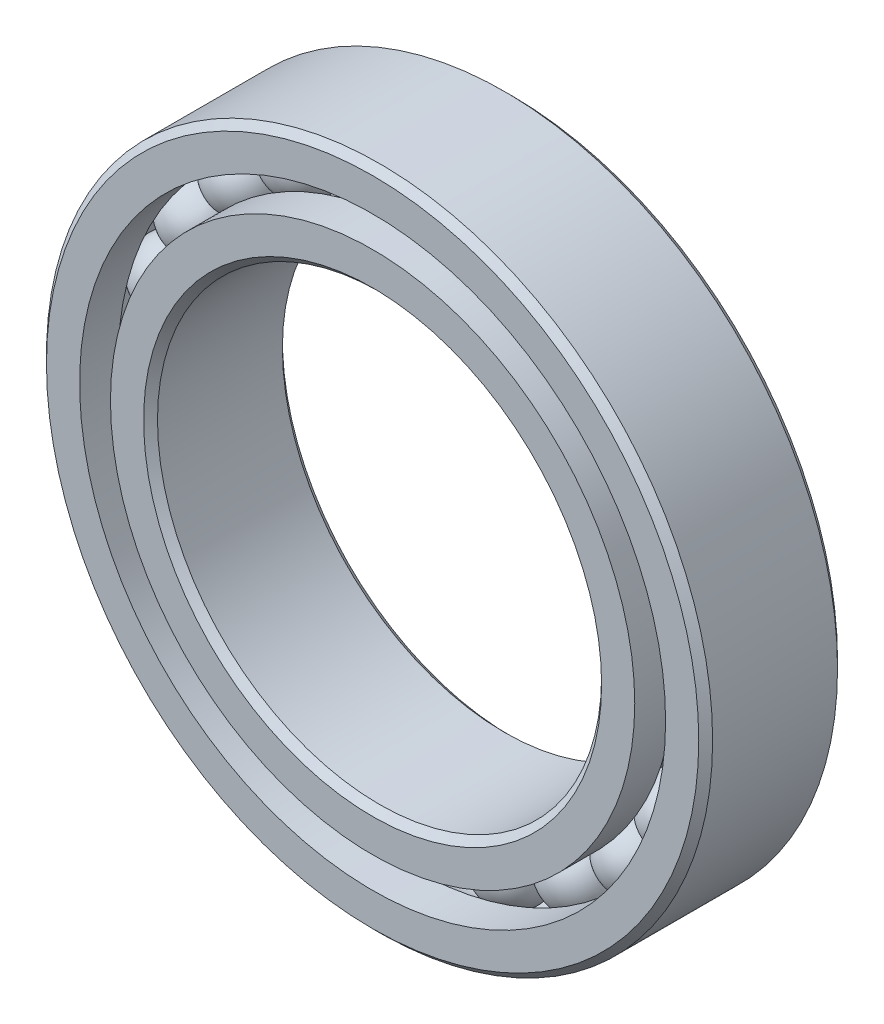
from build123d import *

# Parameters (mm, degrees)
CIRPATTERN1_COUNT = 24


with BuildPart() as part:
    # Sketch2 → Revolve1 (revolve)
    with BuildSketch(Plane(origin=(0, 0, 0), x_dir=(0, 0, -1), z_dir=(1, 0, 0))):
        with BuildLine():
            Line((-1.25, 4.722222222), (-0.555555556, 4.722222222))
            ThreePointArc((-0.555555556, 4.722222222), (0, 4.378870006), (0.555555556, 4.722222222))
            Line((0.555555556, 4.722222222), (1.25, 4.722222222))
            Line((1.25, 4.722222222), (1.25, 4.125))
            Line((1.25, 4.125), (1.125, 4))
            Line((1.125, 4), (-1.125, 4))
            Line((-1.125, 4), (-1.25, 4.125))
            Line((-1.25, 4.125), (-1.25, 4.722222222))
        make_face()
        with BuildLine():
            Line((1.125, 6), (1.25, 5.875))
            Line((1.25, 5.875), (1.25, 5.277777778))
            Line((1.25, 5.277777778), (0.555555556, 5.277777778))
            ThreePointArc((0.555555556, 5.277777778), (0, 5.621129994), (-0.555555556, 5.277777778))
            Line((-0.555555556, 5.277777778), (-1.25, 5.277777778))
            Line((-1.25, 5.277777778), (-1.25, 5.875))
            Line((-1.25, 5.875), (-1.125, 6))
            Line((-1.125, 6), (1.125, 6))
        make_face()
    revolve(axis=Axis((0, 0, 1.25), (0, 0, -1)))


with BuildPart() as body_2:
    # Sketch3 → Revolve2 (revolve)
    with BuildSketch(Plane(origin=(0, 0, 0), x_dir=(0, 0, -1), z_dir=(1, 0, 0))):
        with BuildLine():
            Line((-0.621129994, 5), (0.621129994, 5))
            ThreePointArc((0.621129994, 5), (0, 5.621129994), (-0.621129994, 5))
        make_face()
    revolve(axis=Axis((0, 5, 0.621129994), (0, 0, -1)))


with BuildPart() as cirpattern1_1:
    # CirPattern1: pattern copy
    add(body_2.part.rotate(Axis((0, 0, -1.25), (0, 0, 1)), 1 * 360 / CIRPATTERN1_COUNT))


with BuildPart() as cirpattern1_2:
    # CirPattern1: pattern copy
    add(body_2.part.rotate(Axis((0, 0, -1.25), (0, 0, 1)), 2 * 360 / CIRPATTERN1_COUNT))


with BuildPart() as cirpattern1_3:
    # CirPattern1: pattern copy
    add(body_2.part.rotate(Axis((0, 0, -1.25), (0, 0, 1)), 3 * 360 / CIRPATTERN1_COUNT))


with BuildPart() as cirpattern1_4:
    # CirPattern1: pattern copy
    add(body_2.part.rotate(Axis((0, 0, -1.25), (0, 0, 1)), 4 * 360 / CIRPATTERN1_COUNT))


with BuildPart() as cirpattern1_5:
    # CirPattern1: pattern copy
    add(body_2.part.rotate(Axis((0, 0, -1.25), (0, 0, 1)), 5 * 360 / CIRPATTERN1_COUNT))


with BuildPart() as cirpattern1_6:
    # CirPattern1: pattern copy
    add(body_2.part.rotate(Axis((0, 0, -1.25), (0, 0, 1)), 6 * 360 / CIRPATTERN1_COUNT))


with BuildPart() as cirpattern1_7:
    # CirPattern1: pattern copy
    add(body_2.part.rotate(Axis((0, 0, -1.25), (0, 0, 1)), 7 * 360 / CIRPATTERN1_COUNT))


with BuildPart() as cirpattern1_8:
    # CirPattern1: pattern copy
    add(body_2.part.rotate(Axis((0, 0, -1.25), (0, 0, 1)), 8 * 360 / CIRPATTERN1_COUNT))


with BuildPart() as cirpattern1_9:
    # CirPattern1: pattern copy
    add(body_2.part.rotate(Axis((0, 0, -1.25), (0, 0, 1)), 9 * 360 / CIRPATTERN1_COUNT))


with BuildPart() as cirpattern1_10:
    # CirPattern1: pattern copy
    add(body_2.part.rotate(Axis((0, 0, -1.25), (0, 0, 1)), 10 * 360 / CIRPATTERN1_COUNT))


with BuildPart() as cirpattern1_11:
    # CirPattern1: pattern copy
    add(body_2.part.rotate(Axis((0, 0, -1.25), (0, 0, 1)), 11 * 360 / CIRPATTERN1_COUNT))


with BuildPart() as cirpattern1_12:
    # CirPattern1: pattern copy
    add(body_2.part.rotate(Axis((0, 0, -1.25), (0, 0, 1)), 12 * 360 / CIRPATTERN1_COUNT))


with BuildPart() as cirpattern1_13:
    # CirPattern1: pattern copy
    add(body_2.part.rotate(Axis((0, 0, -1.25), (0, 0, 1)), 13 * 360 / CIRPATTERN1_COUNT))


with BuildPart() as cirpattern1_14:
    # CirPattern1: pattern copy
    add(body_2.part.rotate(Axis((0, 0, -1.25), (0, 0, 1)), 14 * 360 / CIRPATTERN1_COUNT))


with BuildPart() as cirpattern1_15:
    # CirPattern1: pattern copy
    add(body_2.part.rotate(Axis((0, 0, -1.25), (0, 0, 1)), 15 * 360 / CIRPATTERN1_COUNT))


with BuildPart() as cirpattern1_16:
    # CirPattern1: pattern copy
    add(body_2.part.rotate(Axis((0, 0, -1.25), (0, 0, 1)), 16 * 360 / CIRPATTERN1_COUNT))


with BuildPart() as cirpattern1_17:
    # CirPattern1: pattern copy
    add(body_2.part.rotate(Axis((0, 0, -1.25), (0, 0, 1)), 17 * 360 / CIRPATTERN1_COUNT))


with BuildPart() as cirpattern1_18:
    # CirPattern1: pattern copy
    add(body_2.part.rotate(Axis((0, 0, -1.25), (0, 0, 1)), 18 * 360 / CIRPATTERN1_COUNT))


with BuildPart() as cirpattern1_19:
    # CirPattern1: pattern copy
    add(body_2.part.rotate(Axis((0, 0, -1.25), (0, 0, 1)), 19 * 360 / CIRPATTERN1_COUNT))


with BuildPart() as cirpattern1_20:
    # CirPattern1: pattern copy
    add(body_2.part.rotate(Axis((0, 0, -1.25), (0, 0, 1)), 20 * 360 / CIRPATTERN1_COUNT))


with BuildPart() as cirpattern1_21:
    # CirPattern1: pattern copy
    add(body_2.part.rotate(Axis((0, 0, -1.25), (0, 0, 1)), 21 * 360 / CIRPATTERN1_COUNT))


with BuildPart() as cirpattern1_22:
    # CirPattern1: pattern copy
    add(body_2.part.rotate(Axis((0, 0, -1.25), (0, 0, 1)), 22 * 360 / CIRPATTERN1_COUNT))


with BuildPart() as cirpattern1_23:
    # CirPattern1: pattern copy
    add(body_2.part.rotate(Axis((0, 0, -1.25), (0, 0, 1)), 23 * 360 / CIRPATTERN1_COUNT))


solid = Compound([part.part, body_2.part, cirpattern1_1.part, cirpattern1_2.part, cirpattern1_3.part, cirpattern1_4.part, cirpattern1_5.part, cirpattern1_6.part, cirpattern1_7.part, cirpattern1_8.part, cirpattern1_9.part, cirpattern1_10.part, cirpattern1_11.part, cirpattern1_12.part, cirpattern1_13.part, cirpattern1_14.part, cirpattern1_15.part, cirpattern1_16.part, cirpattern1_17.part, cirpattern1_18.part, cirpattern1_19.part, cirpattern1_20.part, cirpattern1_21.part, cirpattern1_22.part, cirpattern1_23.part])
